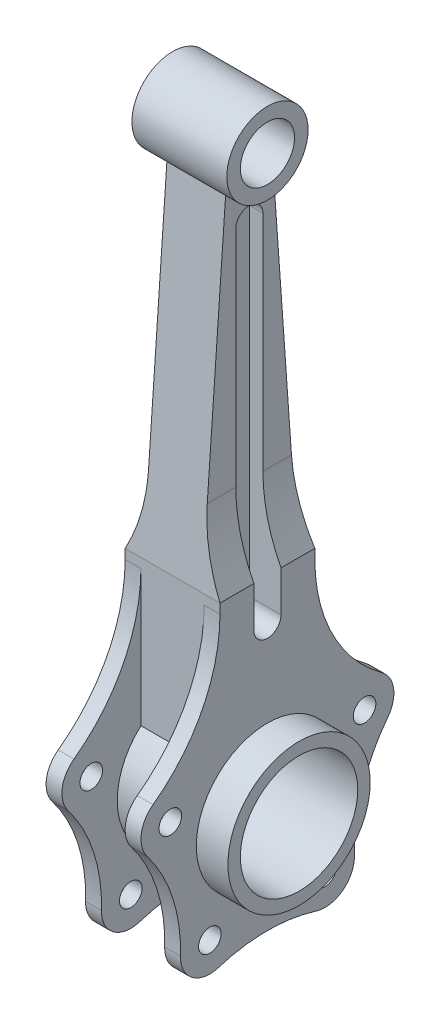
from build123d import *

# Parameters (mm, degrees)
SKETCH1_R           = 31.5
SKETCH1_R_2         = 26
BOSS_EXTRUDE1_DEPTH = 35
SKETCH1_3_R         = 18
SKETCH1_3_R_2       = 12
BOSS_EXTRUDE2_DEPTH = 21
BOSS_EXTRUDE3_DEPTH = 21
BOSS_EXTRUDE4_DEPTH = 7
SKETCH2_R           = 5
BOSS_EXTRUDE5_DEPTH = 7
CUT_EXTRUDE6_START  = -21
CUT_EXTRUDE6_DEPTH  = 42
SKETCH1_7_R         = 18
SKETCH1_7_R_2       = 12
BOSS_EXTRUDE6_DEPTH = 21


with BuildPart() as part:
    # Sketch1 → Boss-Extrude1 (new, symmetric)
    with BuildSketch(Plane.YZ):
        with Locations(Location((0, 0, 0), (0, 0, 270))):
            Circle(SKETCH1_R)
        with Locations(Location((0, 0, 0), (0, 0, 270))):
            Circle(SKETCH1_R_2, mode=Mode.SUBTRACT)
    extrude(amount=BOSS_EXTRUDE1_DEPTH, both=True)



with BuildPart() as body_2:
    # Sketch1<3> → Boss-Extrude2 (new, symmetric)
    with BuildSketch(Plane.YZ):
        with Locations(Location((250, 0, 0), (0, 0, 90))):
            Circle(SKETCH1_3_R)
        with Locations(Location((250, 0, 0), (0, 0, 90))):
            Circle(SKETCH1_3_R_2, mode=Mode.SUBTRACT)
    extrude(amount=BOSS_EXTRUDE2_DEPTH, both=True)


with BuildPart() as part_1:
    add(part.part)

    add(body_2.part)  # Boss-Extrude3 merges body 2
    # Sketch1<4> → Boss-Extrude3 (add, symmetric)
    with BuildSketch(Plane.YZ):
        with BuildLine():
            Line((235.379808483, 10.5), (88, 21))
            Line((88, 21), (23.478713764, 21))
            ThreePointArc((23.478713764, 21), (29.426429307, 11.239895828), (31.5, 0))
            ThreePointArc((31.5, 0), (29.426429307, -11.239895828), (23.478713764, -21))
            Line((23.478713764, -21), (88, -21))
            Line((88, -21), (235.379808483, -10.5))
            ThreePointArc((235.379808483, -10.5), (232, 0), (235.379808483, 10.5))
        make_face()
        with BuildLine():
            ThreePointArc((70, -6), (64, 0), (70, 6))
            Line((70, 6), (220, 6))
            ThreePointArc((220, 6), (226, 0), (220, -6))
            Line((220, -6), (70, -6))
        make_face(mode=Mode.SUBTRACT)
    extrude(amount=BOSS_EXTRUDE3_DEPTH, both=True)

    # Sketch1<5> → Boss-Extrude4 (add, symmetric)
    with BuildSketch(Plane.YZ):
        with BuildLine():
            Line((70, -6), (220, -6))
            ThreePointArc((220, -6), (226, 0), (220, 6))
            Line((220, 6), (70, 6))
            ThreePointArc((70, 6), (64, 0), (70, -6))
        make_face()
    extrude(amount=BOSS_EXTRUDE4_DEPTH, both=True)

    # Sketch2 → Boss-Extrude5 (add)
    with BuildSketch(Plane.YZ.offset(21)):
        with BuildLine():
            ThreePointArc((25.516398298, -50.647058824), (51.072598285, -28.838439215), (83.742065952, -21))
            Line((83.742065952, -21), (23.478713764, -21))
            ThreePointArc((23.478713764, -21), (-31.5, 0), (23.478713764, 21))
            Line((23.478713764, 21), (83.742065952, 21))
            ThreePointArc((83.742065952, 21), (51.072598285, 28.838439215), (25.516398298, 50.647058824))
            ThreePointArc((25.516398298, 50.647058824), (16.869455228, 55.865378029), (7.0962671, 53.318757993))
            ThreePointArc((7.0962671, 53.318757993), (-14.501700837, 41.975317571), (-38.64781523, 38.495228582))
            ThreePointArc((-38.64781523, 38.495228582), (-49.375786098, 33.332181232), (-51.401209618, 21.6))
            ThreePointArc((-51.401209618, 21.6), (-48.08483212, 0), (-51.401209618, -21.6))
            ThreePointArc((-51.401209618, -21.6), (-49.375786098, -33.332181232), (-38.64781523, -38.495228582))
            ThreePointArc((-38.64781523, -38.495228582), (-14.501700837, -41.975317571), (7.0962671, -53.318757993))
            ThreePointArc((7.0962671, -53.318757993), (16.869455228, -55.865378029), (25.516398298, -50.647058824))
        make_face()
        with Locations(Location((15.003430528, -43, 0), (0, 0, 270))):
            Circle(SKETCH2_R, mode=Mode.SUBTRACT)
        with Locations(Location((-39, -25.5, 0), (0, 0, 270))):
            Circle(SKETCH2_R, mode=Mode.SUBTRACT)
        with Locations(Location((-39, 25.5, 0), (0, 0, 270))):
            Circle(SKETCH2_R, mode=Mode.SUBTRACT)
        with Locations(Location((15.003430528, 43, 0), (0, 0, 270))):
            Circle(SKETCH2_R, mode=Mode.SUBTRACT)
    boss_extrude5 = extrude(amount=-BOSS_EXTRUDE5_DEPTH)

    # Mirror1: Boss-Extrude5 across plane
    add(boss_extrude5.mirror(Plane(origin=(0, 0, 0), x_dir=(0, 0, 1), z_dir=(1, 0, 0))))

    # Cut-Extrude6: read off the stored shape, not the designer's step
    # Cut-Extrude6 outline → Cut-Extrude6 (cut)
    with BuildSketch(Plane(origin=(0, 0, 0), x_dir=(0, 1, 0), z_dir=(0, 0, 1)).offset(CUT_EXTRUDE6_START)):
        with BuildLine():
            ThreePointArc((88, 21), (104.014282256, 15.028577262), (120.984845005, 13))
            Line((120.984845005, 13), (235.379808483, 13))
            Line((235.379808483, 13), (235.379808483, 21))
            Line((235.379808483, 21), (88, 21))
        make_face()
    cut_extrude6 = extrude(amount=CUT_EXTRUDE6_DEPTH, mode=Mode.SUBTRACT)

    # Mirror2: Cut-Extrude6 across plane
    add(cut_extrude6.mirror(Plane(origin=(0, 0, 0), x_dir=(0, 0, 1), z_dir=(1, 0, 0))), mode=Mode.SUBTRACT)

    # Sketch1<7> → Boss-Extrude6 (add, symmetric)
    with BuildSketch(Plane.YZ):
        with Locations(Location((250, 0, 0), (0, 0, 270))):
            Circle(SKETCH1_7_R)
        with Locations(Location((250, 0, 0), (0, 0, 90))):
            Circle(SKETCH1_7_R_2, mode=Mode.SUBTRACT)
    extrude(amount=BOSS_EXTRUDE6_DEPTH, both=True)


solid = part_1.part
